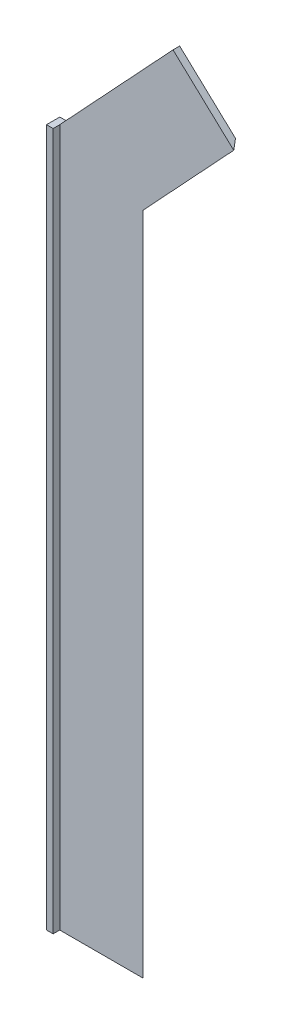
from build123d import *

# Parameters (mm, degrees)
BOSS_EXTRUDE1_DEPTH = 2
SKETCH4_W           = 4
SKETCH4_H           = 210
BOSS_EXTRUDE2_DEPTH = 2
CHAMFER1_SIZE       = 2


with BuildPart() as part:
    # Sketch3 → Boss-Extrude1 (new body)
    with BuildSketch(Plane.XY):
        Polygon((0, 50.432314919), (25, 50.432314919), (25, 250.584553029), (52.383760544, 279.950040998), (34.099918003, 297), (0, 260.432314919), align=None)
    extrude(amount=BOSS_EXTRUDE1_DEPTH)

    # Sketch4 → Boss-Extrude2 (add)
    with BuildSketch(Plane.ZY):
        with Locations((2, 155.432314919)):
            Rectangle(SKETCH4_W, SKETCH4_H)
    extrude(amount=BOSS_EXTRUDE2_DEPTH)

    # Chamfer1
    chamfer1_edges = [part.edges().sort_by_distance(p)[0] for p in [
        (38.691880272, 265.267297014, 0),
        (25, 150.508433974, 0),
    ]]
    chamfer(chamfer1_edges, length=CHAMFER1_SIZE - 0.0001)  # a hair under: the kernel refuses the full size


solid = part.part
